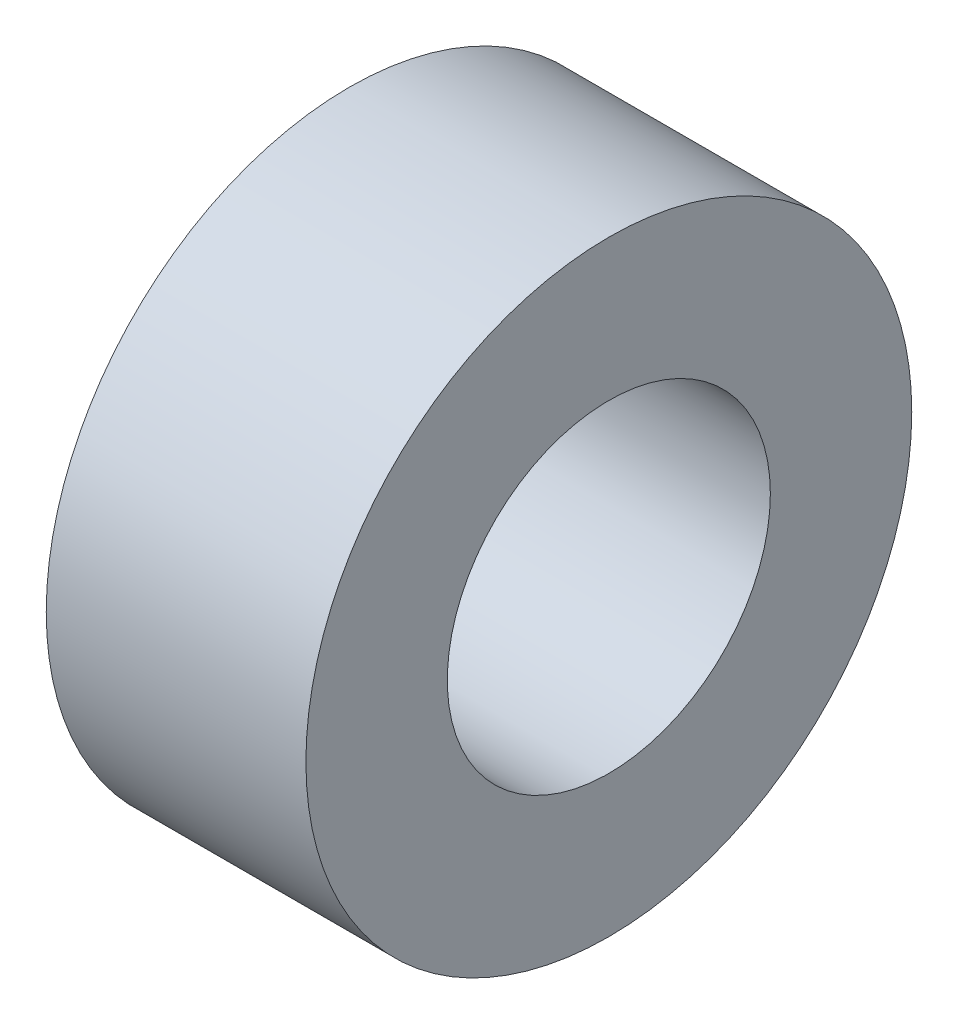
from build123d import *

# Parameters (mm, degrees)
SKETCH1_R           = 7
SKETCH1_R_2         = 3.732593558
BOSS_EXTRUDE1_DEPTH = 6


with BuildPart() as part:
    # Sketch1 → Boss-Extrude1 (new body)
    with BuildSketch(Plane(origin=(0, 0, 0), x_dir=(0, 0, -1), z_dir=(1, 0, 0))):
        Circle(SKETCH1_R)
        Circle(SKETCH1_R_2, mode=Mode.SUBTRACT)
    extrude(amount=BOSS_EXTRUDE1_DEPTH)


solid = part.part
